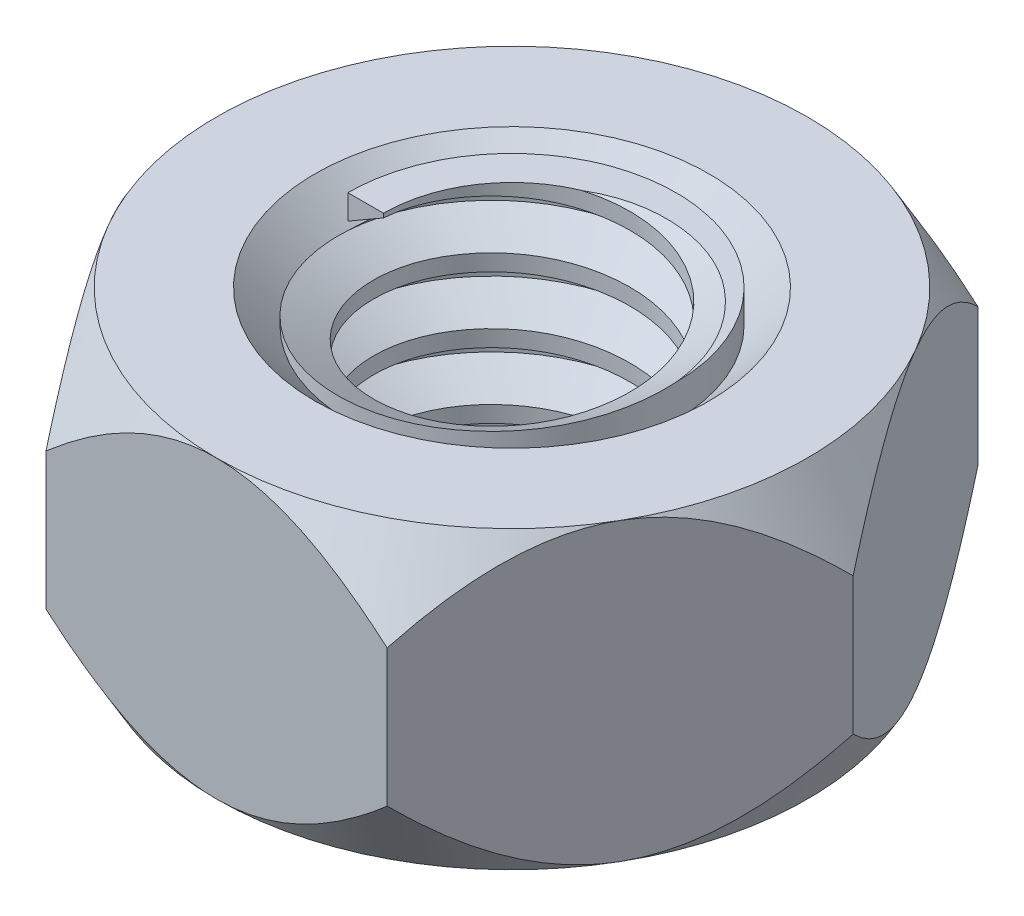
from build123d import *

# Parameters (mm, degrees)
SKETCH2_R               = 2.5
BOSS_EXTRUDE1_DEPTH     = 2.25
SKETCH3_OUTSIDE_W       = 20.482
SKETCH3_OUTSIDE_H       = 19.09
SKETCH3_OUTSIDE_R       = 4.5
CUT_EXTRUDE1_DEPTH      = 4.5
CUT_EXTRUDE1_DRAFT      = -30
MIRROR1_COPY_1_SKETCH_W = 20.482
MIRROR1_COPY_1_SKETCH_H = 19.09
MIRROR1_COPY_1_SKETCH_R = 4.5
MIRROR1_COPY_1_DEPTH    = 4.5
MIRROR1_COPY_1_DRAFT    = -30
CHAMFER1_SIZE           = 0.5
CHAMFER2_SIZE           = 0.5
THREAD1_PITCH           = 1


with BuildPart() as part:
    # Sketch2 → Boss-Extrude1 (new, symmetric)
    with BuildSketch(Plane(origin=(0, 0, 0), x_dir=(1, 0, 0), z_dir=(0, 1, 0))):
        Polygon((2.598076211, 4.5), (-2.598076211, 4.5), (-5.196152423, 0), (-2.598076211, -4.5), (2.598076211, -4.5), (5.196152423, 0), align=None)
        with Locations(Location((0, 0, 0), (0, 0, 270))):
            Circle(SKETCH2_R, mode=Mode.SUBTRACT)
    extrude(amount=BOSS_EXTRUDE1_DEPTH, both=True)


with BuildPart() as cut_extrude1_tool:
    # Sketch3 outside → Cut-Extrude1 (with draft: the straight prism first)
    with BuildSketch(Plane(origin=(0, 2.25, 0), x_dir=(1, 0, 0), z_dir=(0, 1, 0))):
        Rectangle(SKETCH3_OUTSIDE_W, SKETCH3_OUTSIDE_H)
        Circle(SKETCH3_OUTSIDE_R, mode=Mode.SUBTRACT)
    extrude(amount=-CUT_EXTRUDE1_DEPTH)
    # Cut-Extrude1: the draft: its side faces are tilted about the plane it starts from
    cut_extrude1_sides = [cut_extrude1_tool.faces().sort_by_distance(p)[0] for p in [
        (0, 0, 9.545),
        (10.241, 0, 0),
        (0, 0, -9.545),
        (-10.241, 0, 0),
        (-4.5, 0, 0),
    ]]
    draft(cut_extrude1_sides, Plane(origin=(0, 2.25, 0), x_dir=(1, 0, 0), z_dir=(0, 1, 0)), CUT_EXTRUDE1_DRAFT)


with BuildPart() as part_1:
    add(part.part)

    # Cut-Extrude1: cut by cut_extrude1_tool
    add(cut_extrude1_tool.part, mode=Mode.SUBTRACT)


with BuildPart() as mirror1_copy_1_tool:
    # Mirror1 copy 1 sketch → Mirror1 copy 1 (with draft: the straight prism first)
    with BuildSketch(Plane.XZ.offset(2.25)):
        Rectangle(MIRROR1_COPY_1_SKETCH_W, MIRROR1_COPY_1_SKETCH_H)
        Circle(MIRROR1_COPY_1_SKETCH_R, mode=Mode.SUBTRACT)
    extrude(amount=-MIRROR1_COPY_1_DEPTH)
    # Mirror1 copy 1: the draft: its side faces are tilted about the plane it starts from
    mirror1_copy_1_sides = [mirror1_copy_1_tool.faces().sort_by_distance(p)[0] for p in [
        (0, 0, 9.545),
        (10.241, 0, 0),
        (0, 0, -9.545),
        (-10.241, 0, 0),
        (-4.5, 0, 0),
    ]]
    draft(mirror1_copy_1_sides, Plane.XZ.offset(2.25), MIRROR1_COPY_1_DRAFT)


with BuildPart() as part_2:
    add(part_1.part)

    # Mirror1 copy 1: cut by mirror1_copy_1_tool
    add(mirror1_copy_1_tool.part, mode=Mode.SUBTRACT)

    # Chamfer1
    chamfer1_edges = [part_2.edges().sort_by_distance(p)[0] for p in [
        (0, 2.25, -2.5),
    ]]
    chamfer(chamfer1_edges, length=CHAMFER1_SIZE)

    # Chamfer2
    chamfer2_edges = [part_2.edges().sort_by_distance(p)[0] for p in [
        (0, -2.25, -2.5),
    ]]
    chamfer(chamfer2_edges, length=CHAMFER2_SIZE)

    # Thread1: the profile of Thread Profile1 profile screwed along a right-hand helix of 4.5 turns, 8 arcs to a turn; built about Z, then put on its axis
    thread1_z = Axis((0, 0, 0), (0, 0, 1))
    thread1_corners = [(2.5003, 0, -0.000173205), (2.5003, 0, 0.875173202), (1.958734125, 0, 0.562499999), (1.958734125, 0, 0.312499999)]
    with BuildLine(mode=Mode.PRIVATE) as thread1_profile:
        Line(thread1_corners[0], thread1_corners[1])
        Line(thread1_corners[1], thread1_corners[2])
        Line(thread1_corners[2], thread1_corners[3])
        Line(thread1_corners[3], thread1_corners[0])
    thread1_cap = Face(thread1_profile.wire())
    thread1_turn_angles = [0, 22.5, 45, 67.5, 90, 112.5, 135, 157.5, 180, 202.5, 225, 247.5, 270, 292.5, 315, 337.5, 360]
    thread1_turn_weights = [1, 0.9238795325112867, 1, 0.9238795325112867, 1, 0.9238795325112867, 1, 0.9238795325112867, 1, 0.9238795325112867, 1, 0.9238795325112867, 1, 0.9238795325112867, 1, 0.9238795325112867, 1]
    thread1_turn_rails = [Edge.make_bspline([Vector(p[0], p[1], 0).rotate(thread1_z, thread1_turn_angles[k]) / thread1_turn_weights[k] + Vector(0, 0, p[2] + THREAD1_PITCH * thread1_turn_angles[k] / 360) for k in range(17)], [0, 0, 0, 1, 1, 2, 2, 3, 3, 4, 4, 5, 5, 6, 6, 7, 7, 8, 8, 8], 2, thread1_turn_weights) for p in thread1_corners]
    thread1_turn_sides = [Face.make_surface_from_curves(thread1_turn_rails[p[0]], thread1_turn_rails[p[1]]) for p in [(0, 1), (1, 2), (2, 3), (3, 0)]]
    thread1_last_angles = [1440, 1462.5, 1485, 1507.5, 1530, 1552.5, 1575, 1597.5, 1620]
    thread1_last_weights = [1, 0.9238795325112867, 1, 0.9238795325112867, 1, 0.9238795325112867, 1, 0.9238795325112891, 1]
    thread1_last_rails = [Edge.make_bspline([Vector(p[0], p[1], 0).rotate(thread1_z, thread1_last_angles[k]) / thread1_last_weights[k] + Vector(0, 0, p[2] + THREAD1_PITCH * thread1_last_angles[k] / 360) for k in range(9)], [0, 0, 0, 1, 1, 2, 2, 3, 3, 4, 4, 4], 2, thread1_last_weights) for p in thread1_corners]
    thread1_last_sides = [Face.make_surface_from_curves(thread1_last_rails[p[0]], thread1_last_rails[p[1]]) for p in [(0, 1), (1, 2), (2, 3), (3, 0)]]
    thread1 = Plane(origin=(0, 2.75, 0), x_dir=(-1, 0, 0), z_dir=(0, -1, 0)) * Solid(Shell([*[p.moved(Location((0, 0, THREAD1_PITCH * i))) for i in range(4) for p in thread1_turn_sides], *thread1_last_sides, thread1_cap, thread1_cap.rotate(thread1_z, 1620).moved(Location((0, 0, THREAD1_PITCH * 1620 / 360)))]))
    add(thread1)

    # SurfaceCut1
    split(bisect_by=Plane(origin=(0, -2.25, 0), x_dir=(1, 0, 0), z_dir=(0, 1, 0)), keep=Keep.TOP)

    # SurfaceCut2
    split(bisect_by=Plane(origin=(0, 2.25, 0), x_dir=(1, 0, 0), z_dir=(0, 1, 0)), keep=Keep.BOTTOM)


solid = part_2.part
